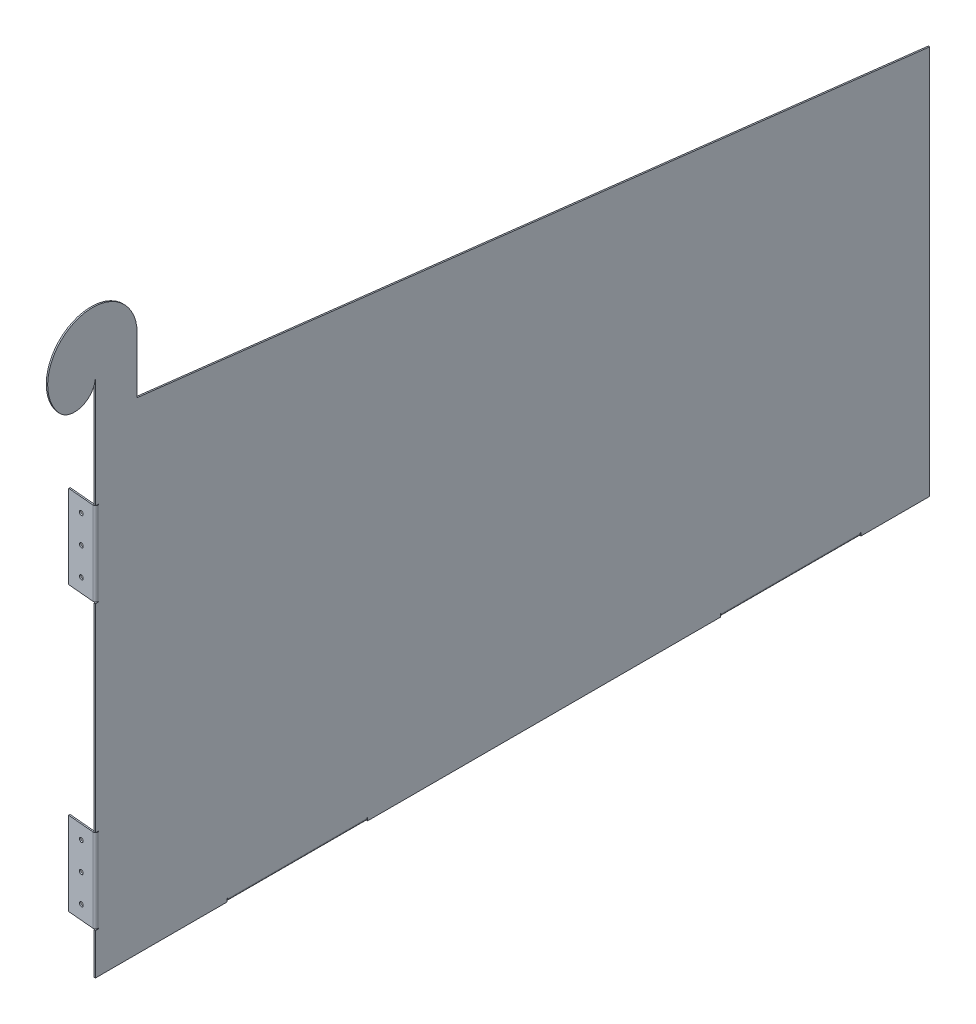
from build123d import *

# Parameters (mm, degrees)
BASE_FLANGE1_DEPTH            = 1
EDGE_FLANGE1_STRIP_W          = 5.4732
EDGE_FLANGE1_STRIP_H          = 1
EDGE_FLANGE1_STRIP_CUT_DEPTH  = 100
EDGE_FLANGE1_RELIEF_W         = 5.9732
EDGE_FLANGE1_RELIEF_H         = 0.5
EDGE_FLANGE1_RELIEF_CUT_DEPTH = 1
EDGE_FLANGE1_DEPTH            = 100
EDGE_FLANGE1_PROFILE_W        = 100
EDGE_FLANGE1_PROFILE_H        = 19.2634
EDGE_FLANGE1_PROFILE_R        = 1.5
EDGE_FLANGE1_FLAT_DEPTH       = 1
EDGE_FLANGE2_START            = -132.311951656
EDGE_FLANGE2_DEPTH            = 61
EDGE_FLANGE2_2_DEPTH          = 0.5
EDGE_FLANGE2_START_2          = -71.811951656
EDGE_FLANGE2_3_DEPTH          = 0.5
EDGE_FLANGE2_START_3          = -131.811951656
EDGE_FLANGE2_4_DEPTH          = 60
EDGE_FLANGE2_START_4          = -321.467617465
EDGE_FLANGE2_5_OUTLINE_R      = 1.5
EDGE_FLANGE2_5_DEPTH          = 1.000000001


with BuildPart() as part:
    # Base-Flange1: sheet metal written as solids
    # Sketch1 → Base-Flange1 (new body)
    with BuildSketch(Plane(origin=(0, 0, 0), x_dir=(0, 0, -1), z_dir=(1, 0, 0))):
        with BuildLine():
            Line((-292.608082875, 184.688048344), (277.391917125, 118.188048344))
            Line((277.391917125, 118.188048344), (277.391917125, -161.811951656))
            Line((277.391917125, -161.811951656), (-322.608082875, -161.811951656))
            Line((-322.608082875, -161.811951656), (-322.608082875, 188.188048344))
            Line((-322.608082875, 188.188048344), (-322.608082875, 213.188048344))
            ThreePointArc((-322.608082875, 213.188048344), (-332.239042701, 199.181856584), (-348.764537222, 203.161407511))
            ThreePointArc((-348.764537222, 203.161407511), (-336.339280516, 254.75856393), (-292.608082875, 224.688048344))
            Line((-292.608082875, 224.688048344), (-292.608082875, 184.688048344))
        make_face()
    extrude(amount=-BASE_FLANGE1_DEPTH)

    # Edge-Flange1: sheet metal written as solids
    # Edge-Flange1 strip (on a plane across the edge) → Edge-Flange1 strip cut (cut)
    with BuildSketch(Plane(origin=(-1, -161.811951656, -227.391917125), x_dir=(0, 1, 0), z_dir=(0, 0, 1))):
        with Locations((-1, -0.5)):
            Rectangle(EDGE_FLANGE1_STRIP_W, EDGE_FLANGE1_STRIP_H)
    edge_flange1_strip_cut = extrude(amount=EDGE_FLANGE1_STRIP_CUT_DEPTH, mode=Mode.SUBTRACT)

    # Edge-Flange1 relief (on the sheet) → Edge-Flange1 relief cut (cut)
    with BuildSketch(Plane(origin=(-1, -160.075351656, -227.391917125), x_dir=(0, 1, 0), z_dir=(-1, 0, 0))):
        with Locations((-2.4866, 0.25)):
            Rectangle(EDGE_FLANGE1_RELIEF_W, EDGE_FLANGE1_RELIEF_H)
        with Locations((-2.4866, -100.25)):
            Rectangle(EDGE_FLANGE1_RELIEF_W, EDGE_FLANGE1_RELIEF_H)
    edge_flange1_relief_cut = extrude(amount=-EDGE_FLANGE1_RELIEF_CUT_DEPTH, mode=Mode.SUBTRACT)

    # Edge-Flange1 bend section (on a plane across the edge) → Edge-Flange1 (add)
    with BuildSketch(Plane(origin=(-1, -161.811951656, -227.391917125), x_dir=(0, 1, 0), z_dir=(0, 0, 1))):
        with BuildLine():
            Line((0, 0.7366), (1, 0.7366))
            ThreePointArc((1, 0.7366), (1.215745145, 0.215745145), (1.7366, 0))
            Line((1.7366, 0), (1.7366, -1))
            ThreePointArc((1.7366, -1), (0.508638364, -0.491361636), (0, 0.7366))
        make_face()
    edge_flange1 = extrude(amount=EDGE_FLANGE1_DEPTH)

    # Edge-Flange1 profile (on flange) → Edge-Flange1 flat (add)
    with BuildSketch(Plane(origin=(-1, -161.811951656, 0), x_dir=(0, 0, -1), z_dir=(0, 1, 0))):
        with Locations((177.391917125, 10.3683)):
            Rectangle(EDGE_FLANGE1_PROFILE_W, EDGE_FLANGE1_PROFILE_H)
        with Locations((142.391917125, 10)):
            Circle(EDGE_FLANGE1_PROFILE_R, mode=Mode.SUBTRACT)
        with Locations((212.391917125, 10)):
            Circle(EDGE_FLANGE1_PROFILE_R, mode=Mode.SUBTRACT)
        with Locations((177.391917125, 10)):
            Circle(EDGE_FLANGE1_PROFILE_R, mode=Mode.SUBTRACT)
    edge_flange1_flat = extrude(amount=EDGE_FLANGE1_FLAT_DEPTH)

    # Mirror1: Edge-Flange1 strip cut, Edge-Flange1 relief cut, Edge-Flange1, Edge-Flange1 flat across plane
    add(edge_flange1_strip_cut.mirror(Plane.XY), mode=Mode.SUBTRACT)
    add(edge_flange1_relief_cut.mirror(Plane.XY), mode=Mode.SUBTRACT)
    add(edge_flange1.mirror(Plane.XY))
    add(edge_flange1_flat.mirror(Plane.XY))

    # Edge-Flange2: read off the stored shape, not the designer's step
    # Edge-Flange2 outline → Edge-Flange2 (cut)
    with BuildSketch(Plane(origin=(0, 0, 0), x_dir=(1, 0, 0), z_dir=(0, 1, 0)).offset(EDGE_FLANGE2_START)):
        with BuildLine():
            Line((0, -322.608082875), (0, -320.800405196))
            ThreePointArc((0, -320.800405196), (-0.271171885, -321.73223136), (-1, -322.373046287))
            Line((-1, -322.373046287), (-1, -322.608082875))
            Line((-1, -322.608082875), (0, -322.608082875))
        make_face()
    edge_flange2 = extrude(amount=EDGE_FLANGE2_DEPTH, mode=Mode.SUBTRACT)

    # Edge-Flange2 2 outline → Edge-Flange2 2 (cut)
    with BuildSketch(Plane(origin=(0, 0, 0), x_dir=(1, 0, 0), z_dir=(0, 1, 0)).offset(EDGE_FLANGE2_START)):
        with BuildLine():
            Line((0, -320.300405196), (-1, -320.300405196))
            Line((-1, -320.300405196), (-1, -322.373046287))
            ThreePointArc((-1, -322.373046287), (-0.271171885, -321.73223136), (0, -320.800405196))
            Line((0, -320.800405196), (0, -320.300405196))
        make_face()
    edge_flange2_2 = extrude(amount=EDGE_FLANGE2_2_DEPTH, mode=Mode.SUBTRACT)

    # Edge-Flange2 3 outline → Edge-Flange2 3 (cut)
    with BuildSketch(Plane(origin=(0, 0, 0), x_dir=(1, 0, 0), z_dir=(0, 1, 0)).offset(EDGE_FLANGE2_START_2)):
        with BuildLine():
            Line((0, -320.300405196), (-1, -320.300405196))
            Line((-1, -320.300405196), (-1, -322.373046287))
            ThreePointArc((-1, -322.373046287), (-0.271171885, -321.73223136), (0, -320.800405196))
            Line((0, -320.800405196), (0, -320.300405196))
        make_face()
    edge_flange2_3 = extrude(amount=EDGE_FLANGE2_3_DEPTH, mode=Mode.SUBTRACT)

    # Edge-Flange2 4 outline → Edge-Flange2 4 (add)
    with BuildSketch(Plane(origin=(0, 0, 0), x_dir=(1, 0, 0), z_dir=(0, 1, 0)).offset(EDGE_FLANGE2_START_3)):
        with BuildLine():
            Line((-1, -322.373046287), (-1, -320.800405196))
            ThreePointArc((-1, -320.800405196), (-1.238960253, -321.343483682), (-1.80079892, -321.53420221))
            Line((-1.80079892, -321.53420221), (-20.923893962, -319.861148183))
            Line((-20.923893962, -319.861148183), (-21.011049705, -320.857342881))
            Line((-21.011049705, -320.857342881), (-1.887954663, -322.530396908))
            ThreePointArc((-1.887954663, -322.530396908), (-1.433585428, -322.510364765), (-1, -322.373046287))
        make_face()
    edge_flange2_4 = extrude(amount=EDGE_FLANGE2_4_DEPTH)

    # Edge-Flange2 5 outline → Edge-Flange2 5 (cut)
    with BuildSketch(Plane(origin=(0, 0, 0), x_dir=(0.9961946980917458, 0, 0.0871557427476548), z_dir=(0.0871557427476548, 0, -0.9961946980917459)).offset(EDGE_FLANGE2_START_4)):
        with Locations((17.033463718, 121.811951656)):
            Circle(EDGE_FLANGE2_5_OUTLINE_R)
        with Locations((17.033463718, 101.811951656)):
            Circle(EDGE_FLANGE2_5_OUTLINE_R)
        with Locations((17.033463718, 81.811951656)):
            Circle(EDGE_FLANGE2_5_OUTLINE_R)
    edge_flange2_5 = extrude(amount=EDGE_FLANGE2_5_DEPTH, mode=Mode.SUBTRACT)

    # Mirror2: Edge-Flange2, Edge-Flange2 2, Edge-Flange2 3, Edge-Flange2 4, Edge-Flange2 5 across plane
    add(edge_flange2.mirror(Plane.ZX), mode=Mode.SUBTRACT)
    add(edge_flange2_2.mirror(Plane.ZX), mode=Mode.SUBTRACT)
    add(edge_flange2_3.mirror(Plane.ZX), mode=Mode.SUBTRACT)
    add(edge_flange2_4.mirror(Plane.ZX))
    add(edge_flange2_5.mirror(Plane.ZX), mode=Mode.SUBTRACT)


solid = part.part
